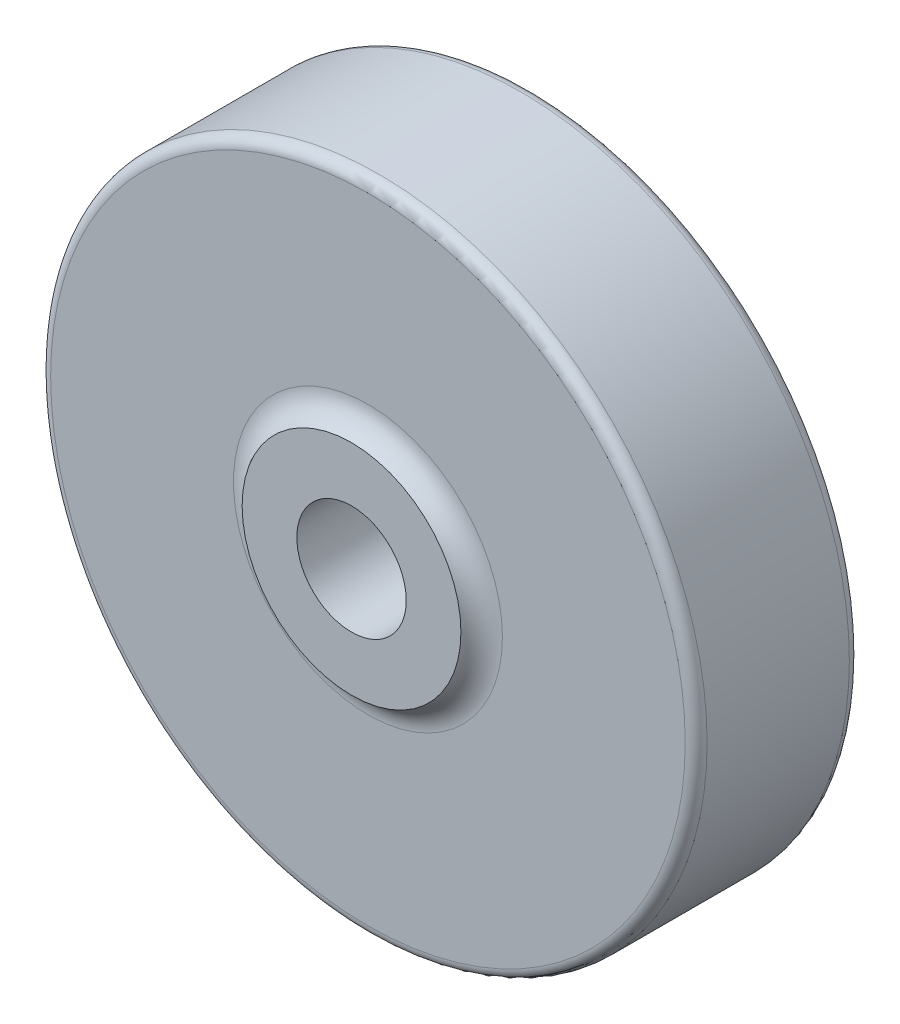
from build123d import *

# Parameters (mm, degrees)
SKETCH1_R           = 60
BOSS_EXTRUDE1_DEPTH = 30
FILLET1_R           = 2
SKETCH6_R           = 20
BOSS_EXTRUDE6_DEPTH = 3
SKETCH9_R           = 10
CUT_EXTRUDE3_DEPTH  = 92.043945535
FILLET4_R           = 5
SKETCH12_R          = 20
BOSS_EXTRUDE9_DEPTH = 3
FILLET7_R           = 5
SKETCH14_R          = 10
CUT_EXTRUDE5_DEPTH  = 93.17374904


with BuildPart() as part:
    # Sketch1 → Boss-Extrude1 (new body)
    with BuildSketch(Plane.XY):
        Circle(SKETCH1_R)
    extrude(amount=BOSS_EXTRUDE1_DEPTH)

    # Fillet1
    fillet1_edges = [part.edges().sort_by_distance(p)[0] for p in [
        (-60, 0, 0),
        (-60, 0, 30),
    ]]
    fillet(fillet1_edges, radius=FILLET1_R)

    # Sketch6 → Boss-Extrude6 (add)
    with BuildSketch(Plane.XY.offset(30)):
        Circle(SKETCH6_R)
    extrude(amount=BOSS_EXTRUDE6_DEPTH)

    # Sketch9 → Cut-Extrude3 (cut, through all)
    with BuildSketch(Plane.XY.offset(33)):
        Circle(SKETCH9_R)
    extrude(amount=-CUT_EXTRUDE3_DEPTH, mode=Mode.SUBTRACT)

    # Fillet4
    # the kernel refuses this fillet: 5 mm, written as the material it adds along each edge
    with BuildSketch(Plane(origin=(0, 0, 30), x_dir=(1, 0, 0), z_dir=(0, -1, 0))) as fillet4_piece_1:
        with BuildLine():
            CenterArc((24.582575695, 5), FILLET4_R, 203.578178478, 66.421821522)
            Line((20, 3), (19.908348486, 2.96))
            ThreePointArc((19.908348486, 2.96), (19.9, 1.5), (19.9, 0))
            Line((19.9, 0), (20, -0.1))
            Line((20, -0.1), (24.582575695, -0.1))
            Line((24.582575695, -0.1), (24.582575695, 0))
        make_face()
    revolve(axis=Axis((0, 0, 30), (0, 0, 1)))

    # Sketch12 → Boss-Extrude9 (add)
    with BuildSketch(Plane(origin=(0, 0, 0), x_dir=(-1, 0, 0), z_dir=(0, 0, -1))):
        with Locations(Location((0, 0, 0), (0, 0, 180))):
            Circle(SKETCH12_R)
    extrude(amount=BOSS_EXTRUDE9_DEPTH)

    # Fillet7
    # the kernel refuses this fillet: 5 mm, written as the material it adds along each edge
    with BuildSketch(Plane(origin=(0, 0, 0), x_dir=(1, 0, 0), z_dir=(0, 1, 0))) as fillet7_piece_1:
        with BuildLine():
            CenterArc((24.582575695, 5), FILLET7_R, 203.578178478, 66.421821522)
            Line((20, 3), (19.908348486, 2.96))
            ThreePointArc((19.908348486, 2.96), (19.9, 1.5), (19.9, 0))
            Line((19.9, 0), (20, -0.1))
            Line((20, -0.1), (24.582575695, -0.1))
            Line((24.582575695, -0.1), (24.582575695, 0))
        make_face()
    revolve(axis=Axis((0, 0, 0), (0, 0, -1)))

    # Sketch14 → Cut-Extrude5 (cut, through all)
    with BuildSketch(Plane(origin=(0, 0, -3), x_dir=(-1, 0, 0), z_dir=(0, 0, -1))):
        with Locations(Location((0, 0, 0), (0, 0, 180))):
            Circle(SKETCH14_R)
    extrude(amount=-CUT_EXTRUDE5_DEPTH, mode=Mode.SUBTRACT)


solid = part.part
